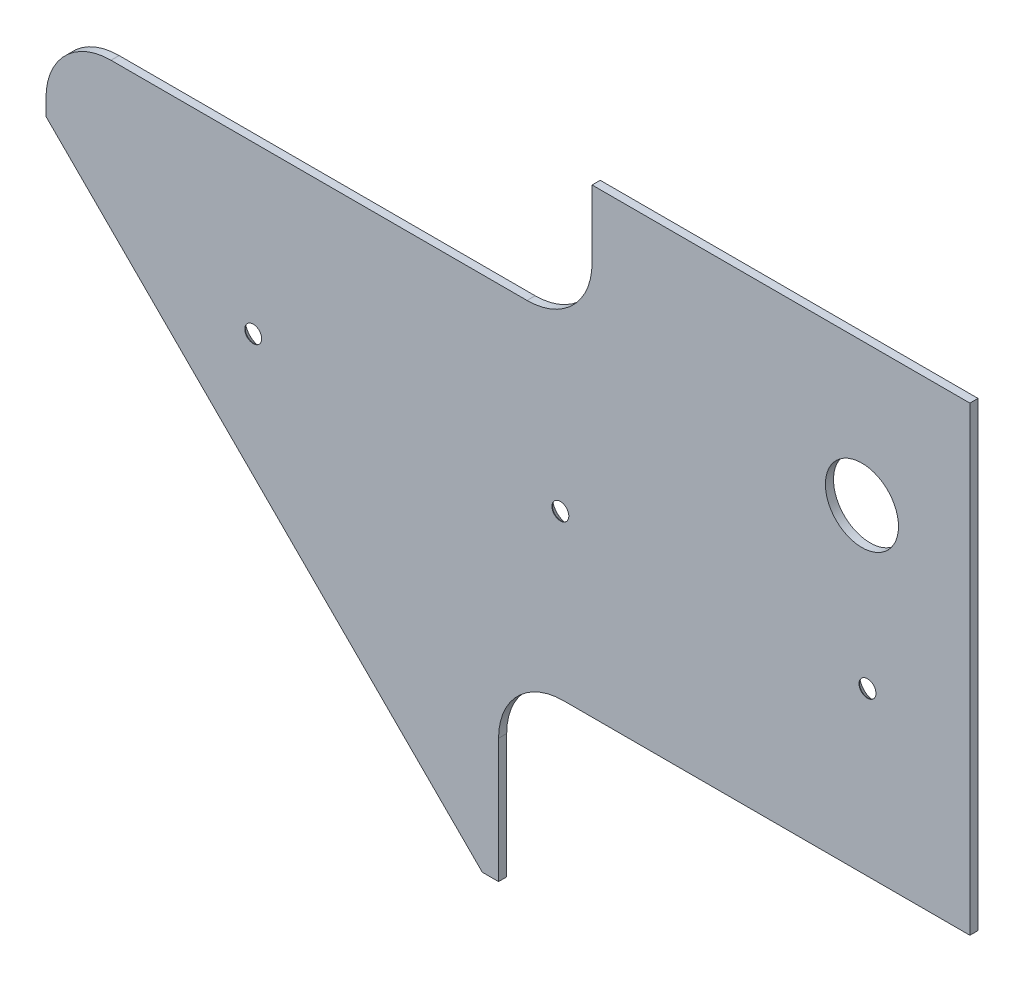
from build123d import *

# Parameters (mm, degrees)
SKETCH1_R                                      = 14.2875
BOSS_EXTRUDE1_DEPTH                            = 3.175
SKETCH2_W                                      = 184.202806358
SKETCH2_H                                      = 73.914
CUT_EXTRUDE1_DEPTH                             = 266.893552722
FILLET1_R                                      = 25.4
SKETCH4_W                                      = 213.36
SKETCH4_H                                      = 64.479988722
CUT_EXTRUDE2_DEPTH                             = 266.893552722
FILLET2_R                                      = 25.4
SKETCH7_W                                      = 147.610011278
SKETCH7_H                                      = 12.7
CUT_EXTRUDE4_DEPTH                             = 266.893552722
CSK_FOR_M6_FLAT_HEAD_MACHINE_SCREW1_AT_2_COUNT = 2
CSK_FOR_M6_FLAT_HEAD_MACHINE_SCREW1_AT_2_PITCH = 120
CSK_FOR_M6_FLAT_HEAD_MACHINE_SCREW1_AT_3_COUNT = 2
CSK_FOR_M6_FLAT_HEAD_MACHINE_SCREW1_AT_3_PITCH = 240


with BuildPart() as part:
    # Sketch1 → Boss-Extrude1 (new body)
    with BuildSketch(Plane.XY):
        Polygon((-138.259383474, 48.991487021), (32.210627804, -121.478524257), (222.710627804, -121.478524257), (222.710627804, 145.221475743), (-138.259383474, 145.221475743), align=None)
        with Locations((180.538014078, 76.831975743)):
            Circle(SKETCH1_R, mode=Mode.SUBTRACT)
    extrude(amount=BOSS_EXTRUDE1_DEPTH)

    # Sketch2 → Cut-Extrude1 (cut, through all)
    with BuildSketch(Plane.XY.offset(3.175)):
        with Locations((130.662030983, -84.521524257)):
            Rectangle(SKETCH2_W, SKETCH2_H)
    extrude(amount=-CUT_EXTRUDE1_DEPTH, mode=Mode.SUBTRACT)

    # Fillet1
    fillet1_edges = [part.edges().sort_by_distance(p)[0] for p in [
        (38.560627804, -47.564524257, 1.5875),
    ]]
    fillet(fillet1_edges, radius=FILLET1_R)

    # Sketch4 → Cut-Extrude2 (cut, through all)
    with BuildSketch(Plane.XY.offset(3.175)):
        with Locations((-31.579383474, 112.981481382)):
            Rectangle(SKETCH4_W, SKETCH4_H)
    extrude(amount=-CUT_EXTRUDE2_DEPTH, mode=Mode.SUBTRACT)

    # Fillet2
    fillet2_edges = [part.edges().sort_by_distance(p)[0] for p in [
        (-138.259383474, 80.741487021, 1.5875),
        (75.100616526, 80.741487021, 1.5875),
    ]]
    fillet(fillet2_edges, radius=FILLET2_R)

    # Sketch7 → Cut-Extrude4 (cut, through all)
    with BuildSketch(Plane.XY.offset(3.175)):
        with Locations((148.905622165, 138.871475743)):
            Rectangle(SKETCH7_W, SKETCH7_H)
    extrude(amount=-CUT_EXTRUDE4_DEPTH, mode=Mode.SUBTRACT)

    # Sketch8 → CSK for M6 Flat Head Machine Screw1 (revolve, cut)
    with BuildSketch(Plane(origin=(182.710627794, 15.935475743, 0), x_dir=(0, 1, 0), z_dir=(1, 0, 0))):
        Polygon((0, 0), (0, 3.175), (3.3, 3.175), (3.3, 3), (6.3, 0), align=None)
    csk_for_m6_flat_head_machine_screw1 = revolve(axis=Axis((182.710627794, 15.935475743, -6.35), (0, 0, 1)), mode=Mode.SUBTRACT)

    # CSK for M6 Flat Head Machine Screw1 at 2: CSK for M6 Flat Head Machine Screw1 ×2
    with Locations(*[(-i * CSK_FOR_M6_FLAT_HEAD_MACHINE_SCREW1_AT_2_PITCH, 0, 0) for i in range(1, CSK_FOR_M6_FLAT_HEAD_MACHINE_SCREW1_AT_2_COUNT)]):
        add(csk_for_m6_flat_head_machine_screw1, mode=Mode.SUBTRACT)

    # CSK for M6 Flat Head Machine Screw1 at 3: CSK for M6 Flat Head Machine Screw1 ×2
    with Locations(*[(-i * CSK_FOR_M6_FLAT_HEAD_MACHINE_SCREW1_AT_3_PITCH, 0, 0) for i in range(1, CSK_FOR_M6_FLAT_HEAD_MACHINE_SCREW1_AT_3_COUNT)]):
        add(csk_for_m6_flat_head_machine_screw1, mode=Mode.SUBTRACT)


solid = part.part
